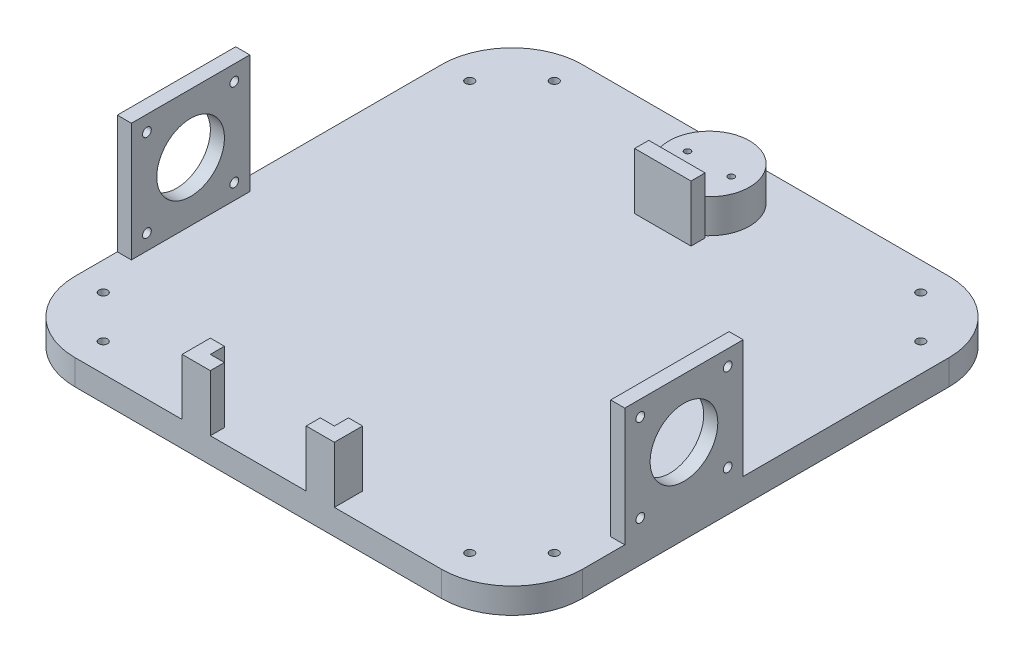
from build123d import *

# Parameters (mm, degrees)
PLATE_DEPTH             = 9
SKETCH3_R               = 1.525
HEX_HOLES_DEPTH         = 128.597021909
SKETCH4_W               = 20
SKETCH4_H               = 5
BATTERY_HOLDER_DEPTH    = 20
SKETCH5_W               = 42
SKETCH5_H               = 42
SKETCH5_R               = 12
SKETCH5_R_2             = 1.55
BOSS_EXTRUDE2_DEPTH     = 5
BOSS_EXTRUDE3_START     = -5
SKETCH6_W               = 42
SKETCH6_H               = 42
SKETCH6_R               = 12
SKETCH6_R_2             = 1.55
BOSS_EXTRUDE3_DEPTH     = 5
SKETCH8_R               = 14.25
BOSS_EXTRUDE4_DEPTH     = 12
SKETCH7_R               = 11.75
CUT_EXTRUDE1_DEPTH      = 10.6
CASTER_HOLES_DEPTH      = 135.029847422
CASTER_HOLES_DEPTH_BACK = 135.029847422
SKETCH2_R               = 1.09


with BuildPart() as part:
    # Sketch1 → Plate (new body)
    with BuildSketch(Plane(origin=(0, 0, 0), x_dir=(1, 0, 0), z_dir=(0, 1, 0))):
        with BuildLine():
            Line((-65, -90), (65, -90))
            ThreePointArc((65, -90), (82.67766953, -82.67766953), (90, -65))
            Line((90, -65), (90, 65))
            ThreePointArc((90, 65), (82.67766953, 82.67766953), (65, 90))
            Line((65, 90), (-65, 90))
            ThreePointArc((-65, 90), (-82.67766953, 82.67766953), (-90, 65))
            Line((-90, 65), (-90, -65))
            ThreePointArc((-90, -65), (-82.67766953, -82.67766953), (-65, -90))
        make_face()
    extrude(amount=PLATE_DEPTH)

    # Sketch3 → Hex Holes (cut, through all)
    with BuildSketch(Plane(origin=(0, 9, 0), x_dir=(1, 0, 0), z_dir=(0, 1, 0))):
        with Locations((-65, 80)):
            Circle(SKETCH3_R)
        with Locations((-80, 65)):
            Circle(SKETCH3_R)
        with Locations((80, 65)):
            Circle(SKETCH3_R)
        with Locations((80, -65)):
            Circle(SKETCH3_R)
        with Locations((65, 80)):
            Circle(SKETCH3_R)
        with Locations((65, -80)):
            Circle(SKETCH3_R)
        with Locations((-65, -80)):
            Circle(SKETCH3_R)
        with Locations((-80, -65)):
            Circle(SKETCH3_R)
    extrude(amount=-HEX_HOLES_DEPTH, mode=Mode.SUBTRACT)

    # Sketch4 → Battery Holder (add)
    with BuildSketch(Plane(origin=(0, 9, 0), x_dir=(1, 0, 0), z_dir=(0, 1, 0))):
        Polygon((-22, -85), (-17, -85), (-17, -90), (-27, -90), (-27, -80), (-22, -80), align=None)
        Polygon((17, -85), (22, -85), (22, -80), (27, -80), (27, -90), (17, -90), align=None)
        with Locations((0, 56)):
            Rectangle(SKETCH4_W, SKETCH4_H)
    extrude(amount=BATTERY_HOLDER_DEPTH)

    # Sketch5 → Boss-Extrude2 (add)
    with BuildSketch(Plane.ZY.offset(90)):
        with Locations((29, 30)):
            Rectangle(SKETCH5_W, SKETCH5_H)
        with Locations((29, 30)):
            Circle(SKETCH5_R, mode=Mode.SUBTRACT)
        with Locations((13.5, 45.5)):
            Circle(SKETCH5_R_2, mode=Mode.SUBTRACT)
        with Locations((44.5, 45.5)):
            Circle(SKETCH5_R_2, mode=Mode.SUBTRACT)
        with Locations((44.5, 14.5)):
            Circle(SKETCH5_R_2, mode=Mode.SUBTRACT)
        with Locations((13.5, 14.5)):
            Circle(SKETCH5_R_2, mode=Mode.SUBTRACT)
    extrude(amount=-BOSS_EXTRUDE2_DEPTH)

    # Sketch6 → Boss-Extrude3 (add)
    with BuildSketch(Plane(origin=(90, 0, 0), x_dir=(0, 0, -1), z_dir=(1, 0, 0)).offset(BOSS_EXTRUDE3_START)):
        with Locations((-29, 30)):
            Rectangle(SKETCH6_W, SKETCH6_H)
        with Locations((-29, 30)):
            Circle(SKETCH6_R, mode=Mode.SUBTRACT)
        with Locations((-44.5, 45.5)):
            Circle(SKETCH6_R_2, mode=Mode.SUBTRACT)
        with Locations((-13.5, 45.5)):
            Circle(SKETCH6_R_2, mode=Mode.SUBTRACT)
        with Locations((-13.5, 14.5)):
            Circle(SKETCH6_R_2, mode=Mode.SUBTRACT)
        with Locations((-44.5, 14.5)):
            Circle(SKETCH6_R_2, mode=Mode.SUBTRACT)
    extrude(amount=BOSS_EXTRUDE3_DEPTH)

    # Sketch8 → Boss-Extrude4 (add)
    with BuildSketch(Plane(origin=(0, 9, 0), x_dir=(1, 0, 0), z_dir=(0, 1, 0))):
        with Locations((0, 70)):
            Circle(SKETCH8_R)
    extrude(amount=BOSS_EXTRUDE4_DEPTH)

    # Sketch7 → Cut-Extrude1 (cut)
    with BuildSketch(Plane.XZ):
        with Locations((0, -70)):
            Circle(SKETCH7_R)
    extrude(amount=-CUT_EXTRUDE1_DEPTH, mode=Mode.SUBTRACT)

    # Sketch2 → Caster Holes (cut, two sides: drawn at the far end of the back side and taken through both)
    with BuildSketch(Plane(origin=(0, 9, 0), x_dir=(1, 0, 0), z_dir=(0, 1, 0)).offset(-CASTER_HOLES_DEPTH_BACK)):
        with Locations((-7.747, 70)):
            Circle(SKETCH2_R)
        with Locations((7.747, 70)):
            Circle(SKETCH2_R)
    extrude(amount=CASTER_HOLES_DEPTH + CASTER_HOLES_DEPTH_BACK, mode=Mode.SUBTRACT)


solid = part.part
